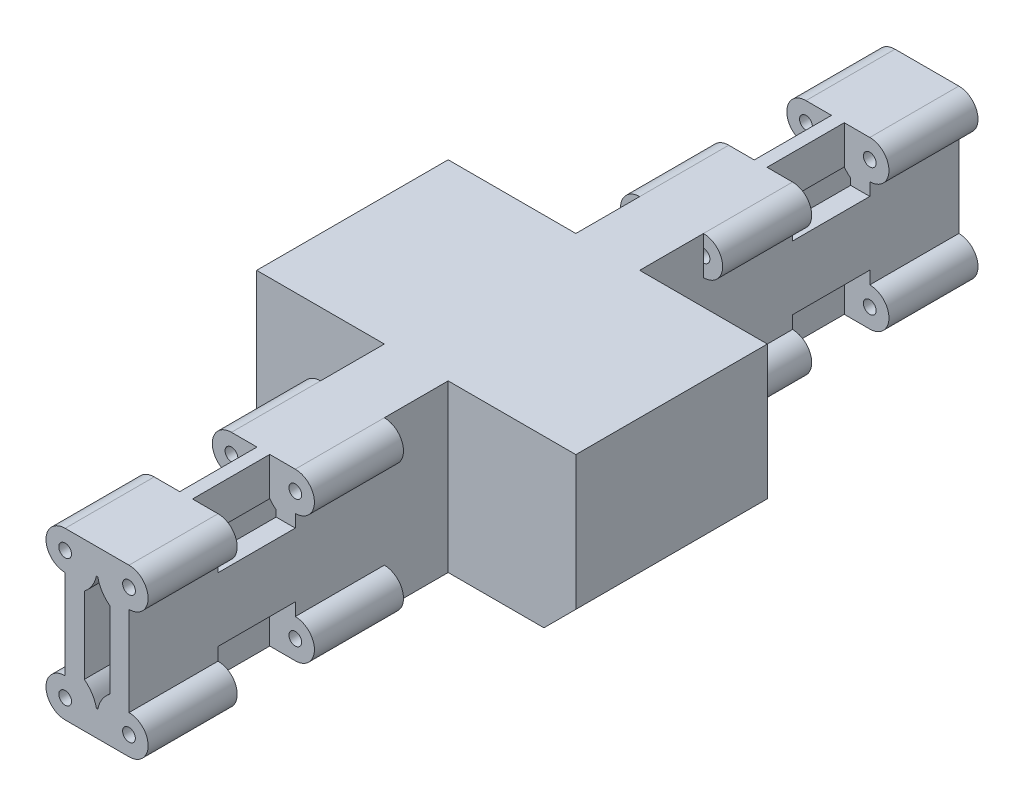
from build123d import *

# Parameters (mm, degrees)
SKETCH_1_W               = 50
SKETCH_1_H               = 26
EXTRUDE_1_DEPTH          = 65
SKETCH_7_W               = 20
SKETCH_7_H               = 26
CUT_EXTRUDE_5_DEPTH      = 50
SKETCH_4_R               = 3
EXTRUDE_3_DEPTH          = 40
SKETCH_5_W               = 12.1
SKETCH_5_H               = 8
CUT_EXTRUDE_3_DEPTH      = 4
SKETCH_6_R               = 1
CUT_EXTRUDE_4_DEPTH      = 40
MIRROR_2_COPY_1_SKETCH_W = 20
MIRROR_2_COPY_1_SKETCH_H = 26
MIRROR_2_COPY_1_DEPTH    = 50
MIRROR_2_COPY_2_SKETCH_R = 3
MIRROR_2_COPY_2_DEPTH    = 40
MIRROR_2_COPY_3_SKETCH_W = 12.1
MIRROR_2_COPY_3_SKETCH_H = 8
MIRROR_2_COPY_3_DEPTH    = 4
MIRROR_2_COPY_4_SKETCH_R = 1
MIRROR_2_COPY_4_DEPTH    = 40
MIRROR_2_COPY_5_SKETCH_W = 20
MIRROR_2_COPY_5_SKETCH_H = 26
MIRROR_2_COPY_5_DEPTH    = 50
MIRROR_2_COPY_6_SKETCH_R = 3
MIRROR_2_COPY_6_DEPTH    = 40
MIRROR_2_COPY_7_SKETCH_W = 12.1
MIRROR_2_COPY_7_SKETCH_H = 8
MIRROR_2_COPY_7_DEPTH    = 4
MIRROR_2_COPY_8_SKETCH_R = 1
MIRROR_2_COPY_8_DEPTH    = 40
CUT_EXTRUDE_7_DEPTH      = 71.89816586
CUT_EXTRUDE_7_DEPTH_BACK = 71.89816586
CUT_EXTRUDE_8_REACH      = 86.862


with BuildPart() as part:
    # Эскиз1 → Бобышка-Вытянуть1 (new, symmetric)
    with BuildSketch(Plane.XY):
        with Locations((0, -0.287208972)):
            Rectangle(SKETCH_1_W, SKETCH_1_H)
    extrude(amount=EXTRUDE_1_DEPTH, both=True)

    # Эскиз7 → Вырез-Вытянуть5 (cut)
    with BuildSketch(Plane.XY.offset(65)):
        with Locations((-15, -0.287208972)):
            Rectangle(SKETCH_7_W, SKETCH_7_H)
    cut_extrude_5 = extrude(amount=-CUT_EXTRUDE_5_DEPTH, mode=Mode.SUBTRACT)

    # Эскиз4 → Бобышка-Вытянуть3 (add)
    with BuildSketch(Plane.XY.offset(65)):
        with Locations((-5, 9.712791028)):
            Circle(SKETCH_4_R)
        with Locations((-5, -10.287208972)):
            Circle(SKETCH_4_R)
    extrude_3 = extrude(amount=-EXTRUDE_3_DEPTH)

    # Эскиз5 → Вырез-Вытянуть3 (cut, symmetric)
    with BuildSketch(Plane.ZY.offset(5)):
        with Locations((45, -9.287208972)):
            Rectangle(SKETCH_5_W, SKETCH_5_H)
        with Locations((45, 8.712791028)):
            Rectangle(SKETCH_5_W, SKETCH_5_H)
    cut_extrude_3 = extrude(amount=CUT_EXTRUDE_3_DEPTH, both=True, mode=Mode.SUBTRACT)

    # Эскиз6 → Вырез-Вытянуть4 (cut)
    with BuildSketch(Plane.XY.offset(65)):
        with Locations((-5, 9.712791028)):
            Circle(SKETCH_6_R)
        with Locations((-5, -10.287208972)):
            Circle(SKETCH_6_R)
    cut_extrude_4 = extrude(amount=-CUT_EXTRUDE_4_DEPTH, mode=Mode.SUBTRACT)

    # Зеркальное отражение1: Вырез-Вытянуть5, Бобышка-Вытянуть3, Вырез-Вытянуть3, Вырез-Вытянуть4 across plane
    add(cut_extrude_5.mirror(Plane.XY), mode=Mode.SUBTRACT)
    add(extrude_3.mirror(Plane.XY))
    add(cut_extrude_3.mirror(Plane.XY), mode=Mode.SUBTRACT)
    add(cut_extrude_4.mirror(Plane.XY), mode=Mode.SUBTRACT)

    # Зеркальное отражение2 copy 1 sketch → Зеркальное отражение2 copy 1 (cut)
    with BuildSketch(Plane(origin=(0, 0, -65), x_dir=(-1, 0, 0), z_dir=(0, 0, -1))):
        with Locations((-15, -0.287208972)):
            Rectangle(MIRROR_2_COPY_1_SKETCH_W, MIRROR_2_COPY_1_SKETCH_H)
    extrude(amount=-MIRROR_2_COPY_1_DEPTH, mode=Mode.SUBTRACT)

    # Зеркальное отражение2 copy 2 sketch → Зеркальное отражение2 copy 2 (add)
    with BuildSketch(Plane(origin=(0, 0, -65), x_dir=(-1, 0, 0), z_dir=(0, 0, -1))):
        with Locations((-5, 9.712791028)):
            Circle(MIRROR_2_COPY_2_SKETCH_R)
        with Locations((-5, -10.287208972)):
            Circle(MIRROR_2_COPY_2_SKETCH_R)
    extrude(amount=-MIRROR_2_COPY_2_DEPTH)

    # Зеркальное отражение2 copy 3 sketch → Зеркальное отражение2 copy 3 (cut, symmetric)
    with BuildSketch(Plane(origin=(5, 0, 0), x_dir=(0, 0, -1), z_dir=(1, 0, 0))):
        with Locations((45, -9.287208972)):
            Rectangle(MIRROR_2_COPY_3_SKETCH_W, MIRROR_2_COPY_3_SKETCH_H)
        with Locations((45, 8.712791028)):
            Rectangle(MIRROR_2_COPY_3_SKETCH_W, MIRROR_2_COPY_3_SKETCH_H)
    extrude(amount=MIRROR_2_COPY_3_DEPTH, both=True, mode=Mode.SUBTRACT)

    # Зеркальное отражение2 copy 4 sketch → Зеркальное отражение2 copy 4 (cut)
    with BuildSketch(Plane(origin=(0, 0, -65), x_dir=(-1, 0, 0), z_dir=(0, 0, -1))):
        with Locations((-5, 9.712791028)):
            Circle(MIRROR_2_COPY_4_SKETCH_R)
        with Locations((-5, -10.287208972)):
            Circle(MIRROR_2_COPY_4_SKETCH_R)
    extrude(amount=-MIRROR_2_COPY_4_DEPTH, mode=Mode.SUBTRACT)

    # Зеркальное отражение2 copy 5 sketch → Зеркальное отражение2 copy 5 (cut)
    with BuildSketch(Plane(origin=(0, 0, 65), x_dir=(-1, 0, 0), z_dir=(0, 0, 1))):
        with Locations((-15, 0.287208972)):
            Rectangle(MIRROR_2_COPY_5_SKETCH_W, MIRROR_2_COPY_5_SKETCH_H)
    extrude(amount=-MIRROR_2_COPY_5_DEPTH, mode=Mode.SUBTRACT)

    # Зеркальное отражение2 copy 6 sketch → Зеркальное отражение2 copy 6 (add)
    with BuildSketch(Plane(origin=(0, 0, 65), x_dir=(-1, 0, 0), z_dir=(0, 0, 1))):
        with Locations((-5, -9.712791028)):
            Circle(MIRROR_2_COPY_6_SKETCH_R)
        with Locations((-5, 10.287208972)):
            Circle(MIRROR_2_COPY_6_SKETCH_R)
    extrude(amount=-MIRROR_2_COPY_6_DEPTH)

    # Зеркальное отражение2 copy 7 sketch → Зеркальное отражение2 copy 7 (cut, symmetric)
    with BuildSketch(Plane(origin=(5, 0, 0), x_dir=(0, 0, 1), z_dir=(1, 0, 0))):
        with Locations((45, 9.287208972)):
            Rectangle(MIRROR_2_COPY_7_SKETCH_W, MIRROR_2_COPY_7_SKETCH_H)
        with Locations((45, -8.712791028)):
            Rectangle(MIRROR_2_COPY_7_SKETCH_W, MIRROR_2_COPY_7_SKETCH_H)
    extrude(amount=MIRROR_2_COPY_7_DEPTH, both=True, mode=Mode.SUBTRACT)

    # Зеркальное отражение2 copy 8 sketch → Зеркальное отражение2 copy 8 (cut)
    with BuildSketch(Plane(origin=(0, 0, 65), x_dir=(-1, 0, 0), z_dir=(0, 0, 1))):
        with Locations((-5, -9.712791028)):
            Circle(MIRROR_2_COPY_8_SKETCH_R)
        with Locations((-5, 10.287208972)):
            Circle(MIRROR_2_COPY_8_SKETCH_R)
    extrude(amount=-MIRROR_2_COPY_8_DEPTH, mode=Mode.SUBTRACT)

    # Эскиз9 → Вырез-Вытянуть7 (cut, two sides: drawn at the far end of the back side and taken through both)
    with BuildSketch(Plane.XY.offset(-CUT_EXTRUDE_7_DEPTH_BACK)):
        with BuildLine():
            Line((0.101020514, 8.712791028), (-0.101020514, 8.712791028))
            ThreePointArc((-0.101020514, 8.712791028), (-0.775255129, 7.038556414), (-2, 5.712791028))
            Line((-2, 5.712791028), (-2, -6.287208972))
            ThreePointArc((-2, -6.287208972), (-0.775255129, -7.612974358), (-0.101020514, -9.287208972))
            Line((-0.101020514, -9.287208972), (0.101020514, -9.287208972))
            ThreePointArc((0.101020514, -9.287208972), (0.775255129, -7.612974358), (2, -6.287208972))
            Line((2, -6.287208972), (2, 5.712791028))
            ThreePointArc((2, 5.712791028), (0.775255129, 7.038556414), (0.101020514, 8.712791028))
        make_face()
    extrude(amount=CUT_EXTRUDE_7_DEPTH + CUT_EXTRUDE_7_DEPTH_BACK, mode=Mode.SUBTRACT)

    # Эскиз10 → Вырез-Вытянуть8 (cut, up to next)
    with BuildSketch(Plane.XY.offset(15), mode=Mode.PRIVATE) as cut_extrude_8_sk1:
        Polygon((25, -8.287208972), (20, -13.287208972), (25, -13.287208972), align=None)
    cut_extrude_8_tool1 = extrude(cut_extrude_8_sk1.sketch, amount=-CUT_EXTRUDE_8_REACH, mode=Mode.PRIVATE) & part.part
    # Эскиз10 → Вырез-Вытянуть8 (cut, up to next)
    with BuildSketch(Plane.XY.offset(15), mode=Mode.PRIVATE) as cut_extrude_8_sk2:
        Polygon((-20, -13.287208972), (-25, -8.287208972), (-25, -13.287208972), align=None)
    cut_extrude_8_tool2 = extrude(cut_extrude_8_sk2.sketch, amount=-CUT_EXTRUDE_8_REACH, mode=Mode.PRIVATE) & part.part
    add(cut_extrude_8_tool1.solids().sort_by_distance((23.333333, -11.620542, 15))[0], mode=Mode.SUBTRACT)
    add(cut_extrude_8_tool2.solids().sort_by_distance((-23.333333, -11.620542, 15))[0], mode=Mode.SUBTRACT)


solid = part.part
